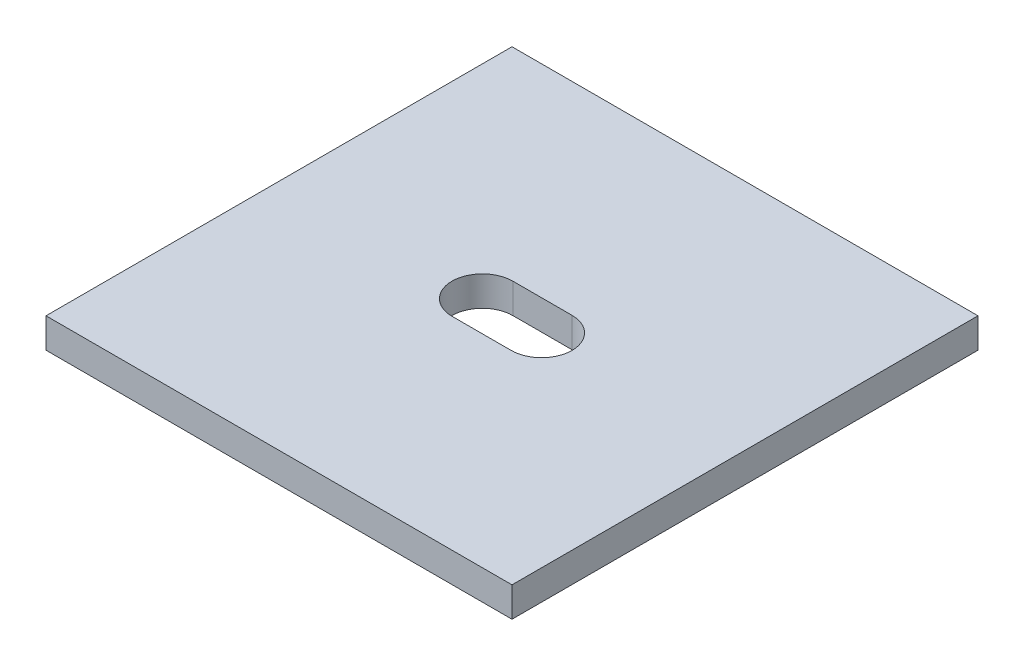
from build123d import *

# Parameters (mm, degrees)
SKETCH1_W                   = 50
SKETCH1_H                   = 50
BOSS_EXTRUDE1_DEPTH         = 3.2
F_1_4_CLEARANCE_SLOT2_DEPTH = 3.2


# Read off the part's stored shape, not the designer's step: 1/4 Clearance Slot2
with BuildPart() as part:
    # Sketch1 → Boss-Extrude1 (new body)
    with BuildSketch(Plane(origin=(0, 0, 0), x_dir=(1, 0, 0), z_dir=(0, 1, 0))):
        Rectangle(SKETCH1_W, SKETCH1_H)
    extrude(amount=BOSS_EXTRUDE1_DEPTH)

    # 1/4 Clearance Slot2 outline → 1/4 Clearance Slot2 (cut)
    with BuildSketch(Plane(origin=(0, 0, 0), x_dir=(1, 0, 0), z_dir=(0, 1, 0))):
        with BuildLine():
            Line((-3.175, -3.2639), (3.175, -3.2639))
            ThreePointArc((3.175, -3.2639), (6.4389, 0), (3.175, 3.2639))
            Line((3.175, 3.2639), (-3.175, 3.2639))
            ThreePointArc((-3.175, 3.2639), (-6.4389, 0), (-3.175, -3.2639))
        make_face()
    extrude(amount=F_1_4_CLEARANCE_SLOT2_DEPTH, mode=Mode.SUBTRACT)


solid = part.part
